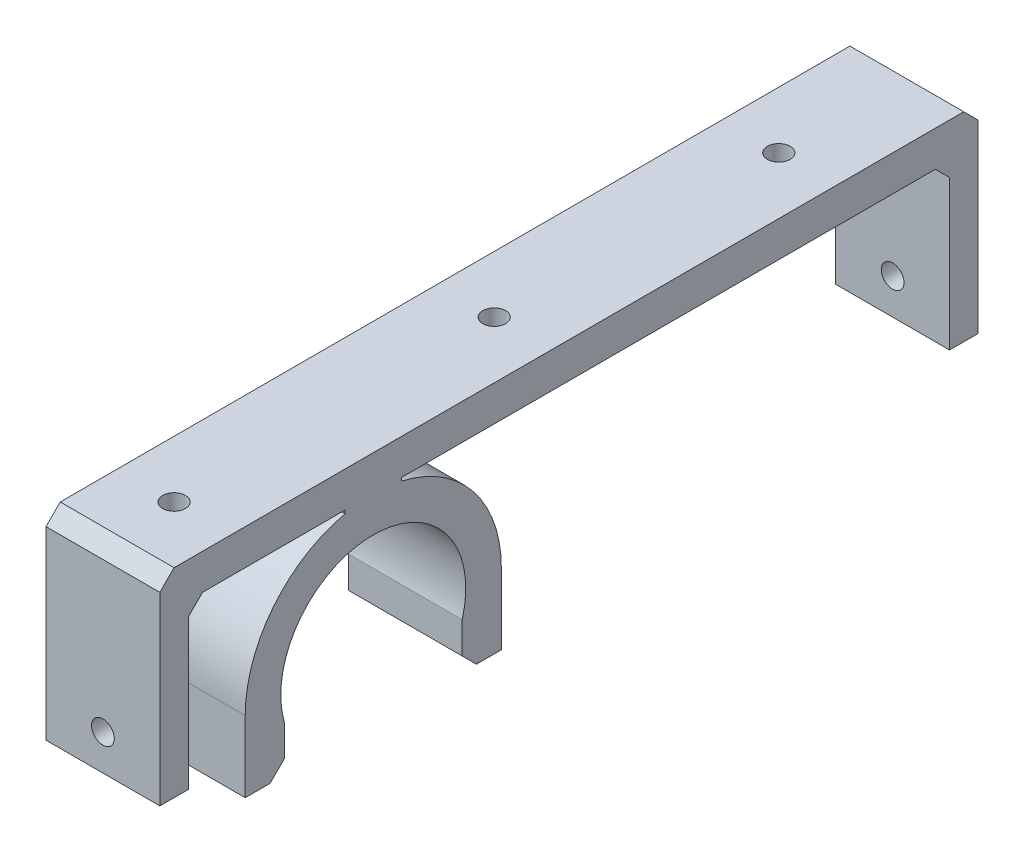
from build123d import *

# Parameters (mm, degrees)
BOSS_EXTRUDE1_DEPTH = 8
CHAMFER1_SIZE       = 2
CHAMFER2_SIZE       = 2
CUT_EXTRUDE1_REACH  = 119.55
SKETCH2_R           = 1.6
CUT_EXTRUDE2_REACH  = 119.55
SKETCH3_R           = 1.6
CUT_EXTRUDE3_REACH  = 93.531
SKETCH4_R           = 1.6


with BuildPart() as part:
    # Sketch1 → Boss-Extrude1 (new, symmetric)
    with BuildSketch(Plane(origin=(0, 0, 0), x_dir=(0, 0, -1), z_dir=(1, 0, 0))):
        with BuildLine():
            Line((-12.5, -3.570714214), (-12.5, -10))
            Line((-12.5, -10), (-18, -10))
            Line((-18, -10), (-18, 0))
            ThreePointArc((-18, 0), (-14.063324203, 11.234897078), (-3.97523196, 17.555555556))
            ThreePointArc((-3.97523196, 17.555555556), (-3.99380319, 17.777432976), (-4, 18))
            Line((-4, 18), (-26, 18))
            Line((-26, 18), (-26, -5))
            Line((-26, -5), (-30, -5))
            Line((-30, -5), (-30, 18))
            Line((-30, 18), (-30, 23))
            Line((-30, 23), (85, 23))
            Line((85, 23), (85, 18))
            Line((85, 18), (85, -5))
            Line((85, -5), (81, -5))
            Line((81, -5), (81, 18))
            Line((81, 18), (4, 18))
            ThreePointArc((4, 18), (3.99380319, 17.777432976), (3.97523196, 17.555555556))
            ThreePointArc((3.97523196, 17.555555556), (14.063324203, 11.234897078), (18, 0))
            Line((18, 0), (18, -10))
            Line((18, -10), (12.5, -10))
            Line((12.5, -10), (12.5, -3.570714214))
            ThreePointArc((12.5, -3.570714214), (0, 13), (-12.5, -3.570714214))
        make_face()
    extrude(amount=BOSS_EXTRUDE1_DEPTH, both=True)

    # Chamfer1
    chamfer1_edges = [part.edges().sort_by_distance(p)[0] for p in [
        (0, 18, -81),
        (0, 18, 26),
    ]]
    chamfer(chamfer1_edges, length=CHAMFER1_SIZE)

    # Chamfer2
    chamfer2_edges = [part.edges().sort_by_distance(p)[0] for p in [
        (0, -10, -12.5),
        (0, -10, 12.5),
        (0, 23, -85),
        (0, 23, 30),
    ]]
    chamfer(chamfer2_edges, length=CHAMFER2_SIZE)

    # Sketch2 → Cut-Extrude1 (cut, up to next)
    with BuildSketch(Plane.XY.offset(30), mode=Mode.PRIVATE) as cut_extrude1_sk1:
        Circle(SKETCH2_R)
    cut_extrude1_tool1 = extrude(cut_extrude1_sk1.sketch, amount=-CUT_EXTRUDE1_REACH, mode=Mode.PRIVATE) & part.part
    add(cut_extrude1_tool1.solids().sort_by_distance((0, 0, 30))[0], mode=Mode.SUBTRACT)

    # Sketch3 → Cut-Extrude2 (cut, up to next)
    with BuildSketch(Plane(origin=(0, 0, -85), x_dir=(-1, 0, 0), z_dir=(0, 0, -1)), mode=Mode.PRIVATE) as cut_extrude2_sk1:
        Circle(SKETCH3_R)
    cut_extrude2_tool1 = extrude(cut_extrude2_sk1.sketch, amount=-CUT_EXTRUDE2_REACH, mode=Mode.PRIVATE) & part.part
    add(cut_extrude2_tool1.solids().sort_by_distance((0, 0, -85))[0], mode=Mode.SUBTRACT)

    # Sketch4 → Cut-Extrude3 (cut, up to next)
    with BuildSketch(Plane(origin=(0, 23, 0), x_dir=(1, 0, 0), z_dir=(0, 1, 0)), mode=Mode.PRIVATE) as cut_extrude3_sk1:
        with Locations((0, 65)):
            Circle(SKETCH4_R)
    cut_extrude3_tool1 = extrude(cut_extrude3_sk1.sketch, amount=-CUT_EXTRUDE3_REACH, mode=Mode.PRIVATE) & part.part
    # Sketch4 → Cut-Extrude3 (cut, up to next)
    with BuildSketch(Plane(origin=(0, 23, 0), x_dir=(1, 0, 0), z_dir=(0, 1, 0)), mode=Mode.PRIVATE) as cut_extrude3_sk2:
        with Locations((0, 25)):
            Circle(SKETCH4_R)
    cut_extrude3_tool2 = extrude(cut_extrude3_sk2.sketch, amount=-CUT_EXTRUDE3_REACH, mode=Mode.PRIVATE) & part.part
    # Sketch4 → Cut-Extrude3 (cut, up to next)
    with BuildSketch(Plane(origin=(0, 23, 0), x_dir=(1, 0, 0), z_dir=(0, 1, 0)), mode=Mode.PRIVATE) as cut_extrude3_sk3:
        with Locations((0, -20)):
            Circle(SKETCH4_R)
    cut_extrude3_tool3 = extrude(cut_extrude3_sk3.sketch, amount=-CUT_EXTRUDE3_REACH, mode=Mode.PRIVATE) & part.part
    add(cut_extrude3_tool1.solids().sort_by_distance((0, 23, -65))[0], mode=Mode.SUBTRACT)
    add(cut_extrude3_tool2.solids().sort_by_distance((0, 23, -25))[0], mode=Mode.SUBTRACT)
    add(cut_extrude3_tool3.solids().sort_by_distance((0, 23, 20))[0], mode=Mode.SUBTRACT)


solid = part.part
